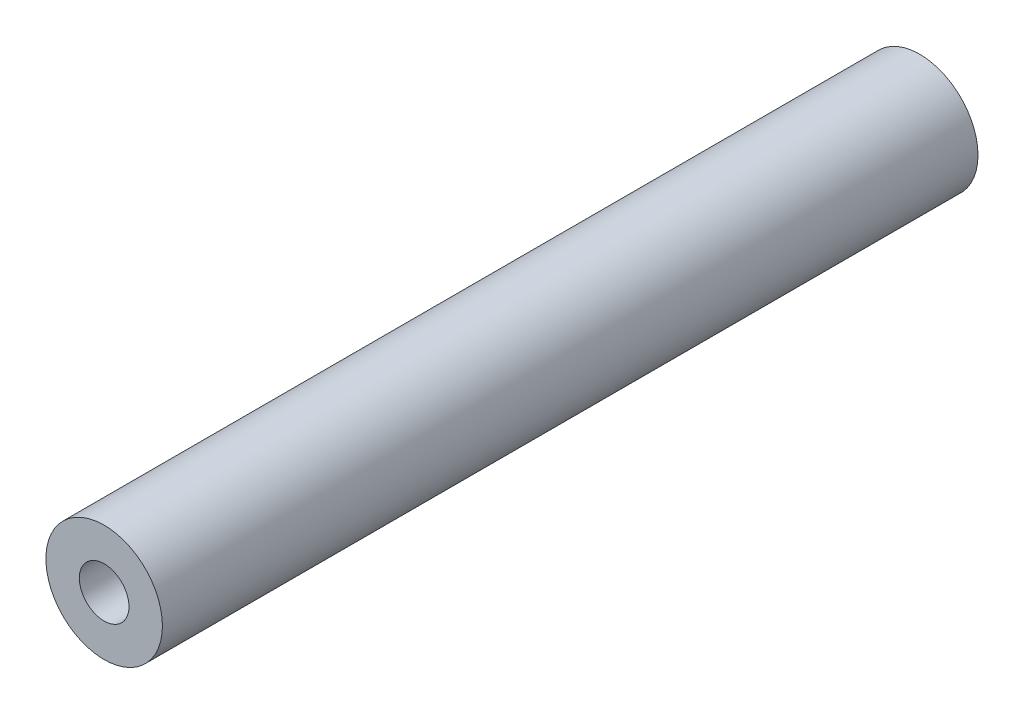
from build123d import *

# Parameters (mm, degrees)
SKETCH1_R           = 3.175
BOSS_EXTRUDE1_DEPTH = 44.45


with BuildPart() as part:
    # Sketch1 → Boss-Extrude1 (new body)
    with BuildSketch(Plane.XY):
        Circle(SKETCH1_R)
    extrude(amount=BOSS_EXTRUDE1_DEPTH)

    # Sketch4 → #6-32 Tapped Hole1 (revolve, cut)
    with BuildSketch(Plane(origin=(0, 0, 44.45), x_dir=(0, -1, 0), z_dir=(1, 0, 0))):
        Polygon((0, 0), (0, 13.51269403), (1.35255, 12.7), (1.35255, 0), align=None)
    f_6_32_tapped_hole1 = revolve(axis=Axis((0, 0, 50.8), (0, 0, -1)), mode=Mode.SUBTRACT)

    # Mirror1: #6-32 Tapped Hole1 across plane
    add(f_6_32_tapped_hole1.mirror(Plane.XY.offset(22.225)), mode=Mode.SUBTRACT)


solid = part.part
